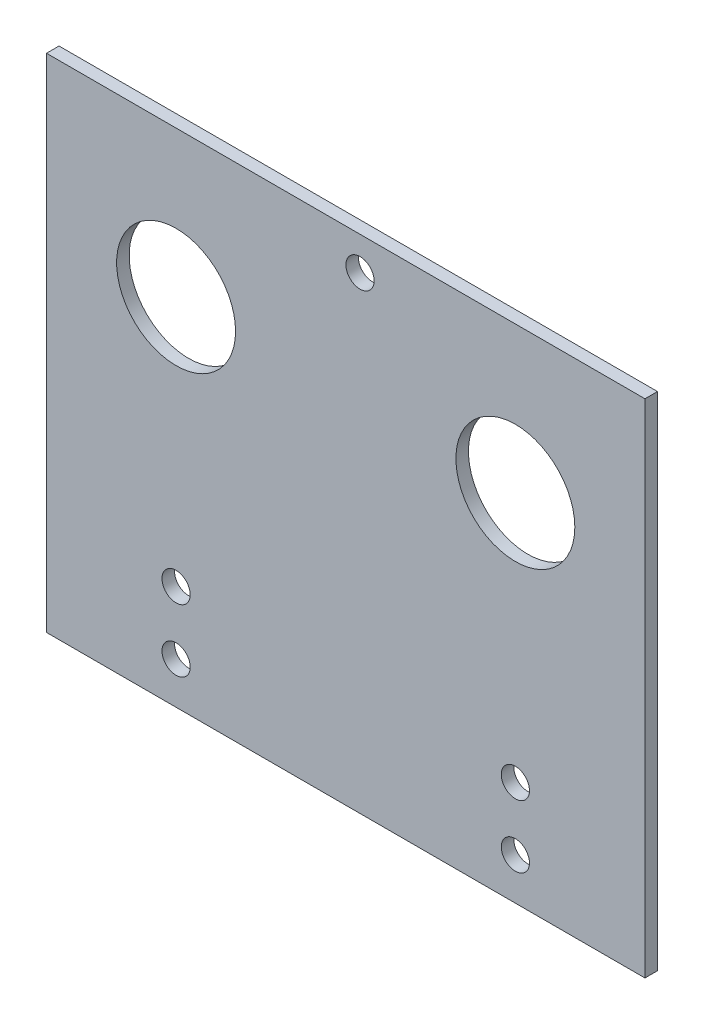
from build123d import *

# Parameters (mm, degrees)
SKETCH1_W           = 143.16
SKETCH1_H           = 120
BOSS_EXTRUDE1_DEPTH = 3
SKETCH2_R           = 14.225
SKETCH2_R_2         = 3.375
CUT_EXTRUDE1_DEPTH  = 187.825548574


with BuildPart() as part:
    # Sketch1 → Boss-Extrude1 (new body)
    with BuildSketch(Plane.XY):
        with Locations((71.58, -60)):
            Rectangle(SKETCH1_W, SKETCH1_H)
    extrude(amount=BOSS_EXTRUDE1_DEPTH)

    # Sketch2 → Cut-Extrude1 (cut, through all)
    with BuildSketch(Plane.XY.offset(3)):
        with Locations((31, -35)):
            Circle(SKETCH2_R)
        with Locations((112.16, -35)):
            Circle(SKETCH2_R)
        with Locations((31, -110)):
            Circle(SKETCH2_R_2)
        with Locations((112.16, -110)):
            Circle(SKETCH2_R_2)
        with Locations((75, -8)):
            Circle(SKETCH2_R_2)
        with Locations((31, -95)):
            Circle(SKETCH2_R_2)
        with Locations((112.16, -95)):
            Circle(SKETCH2_R_2)
    extrude(amount=-CUT_EXTRUDE1_DEPTH, mode=Mode.SUBTRACT)


solid = part.part
